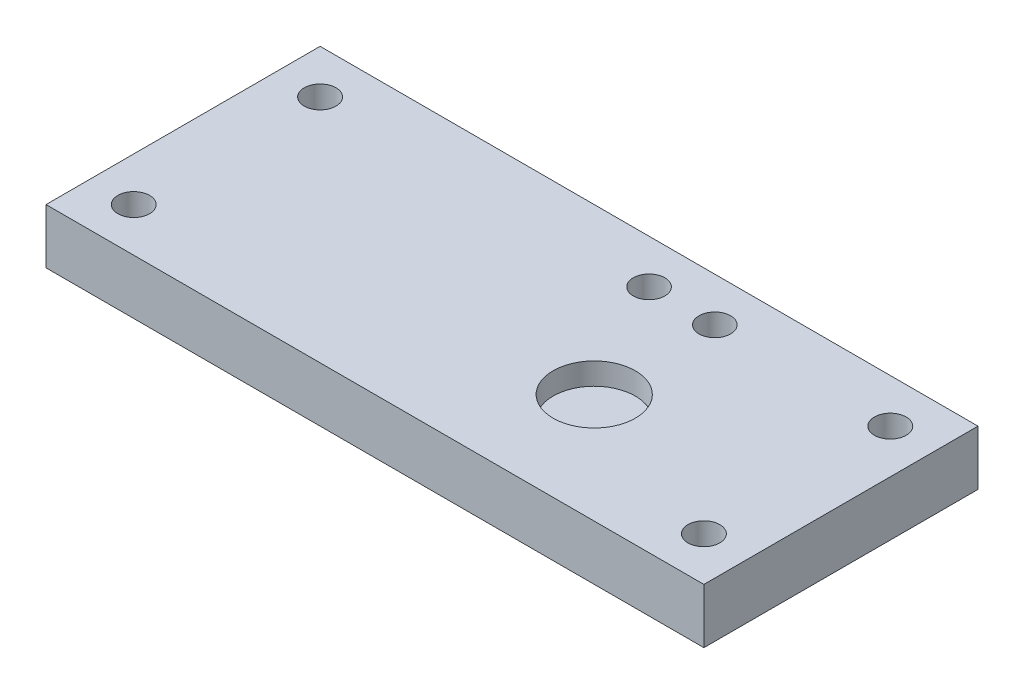
from build123d import *

# Parameters (mm, degrees)
SKETCH1_W           = 76.2
SKETCH1_H           = 31.75
BOSS_EXTRUDE1_DEPTH = 6.35
SKETCH2_R           = 1.8415
CUT_EXTRUDE1_DEPTH  = 42.760604941
SKETCH3_R           = 4.7625
SKETCH3_R_2         = 1.8288
CUT_EXTRUDE2_DEPTH  = 2.54


with BuildPart() as part:
    # Sketch1 → Boss-Extrude1 (new body)
    with BuildSketch(Plane(origin=(0, 0, 0), x_dir=(1, 0, 0), z_dir=(0, 1, 0))):
        Rectangle(SKETCH1_W, SKETCH1_H)
    extrude(amount=BOSS_EXTRUDE1_DEPTH)

    # Sketch2 → Cut-Extrude1 (cut, through all)
    with BuildSketch(Plane(origin=(0, 6.35, 0), x_dir=(1, 0, 0), z_dir=(0, 1, 0))):
        with Locations((-33.02, 10.795)):
            Circle(SKETCH2_R)
        with Locations((-33.02, -10.795)):
            Circle(SKETCH2_R)
        with Locations((33.02, -10.795)):
            Circle(SKETCH2_R)
        with Locations((33.02, 10.795)):
            Circle(SKETCH2_R)
    extrude(amount=-CUT_EXTRUDE1_DEPTH, mode=Mode.SUBTRACT)

    # Sketch3 → Cut-Extrude2 (cut)
    with BuildSketch(Plane(origin=(0, 6.35, 0), x_dir=(1, 0, 0), z_dir=(0, 1, 0))):
        with Locations((12.7, -3.175)):
            Circle(SKETCH3_R)
        with Locations((5.08, 10.795)):
            Circle(SKETCH3_R_2)
        with Locations((12.7, 10.795)):
            Circle(SKETCH3_R_2)
    extrude(amount=-CUT_EXTRUDE2_DEPTH, mode=Mode.SUBTRACT)


solid = part.part
